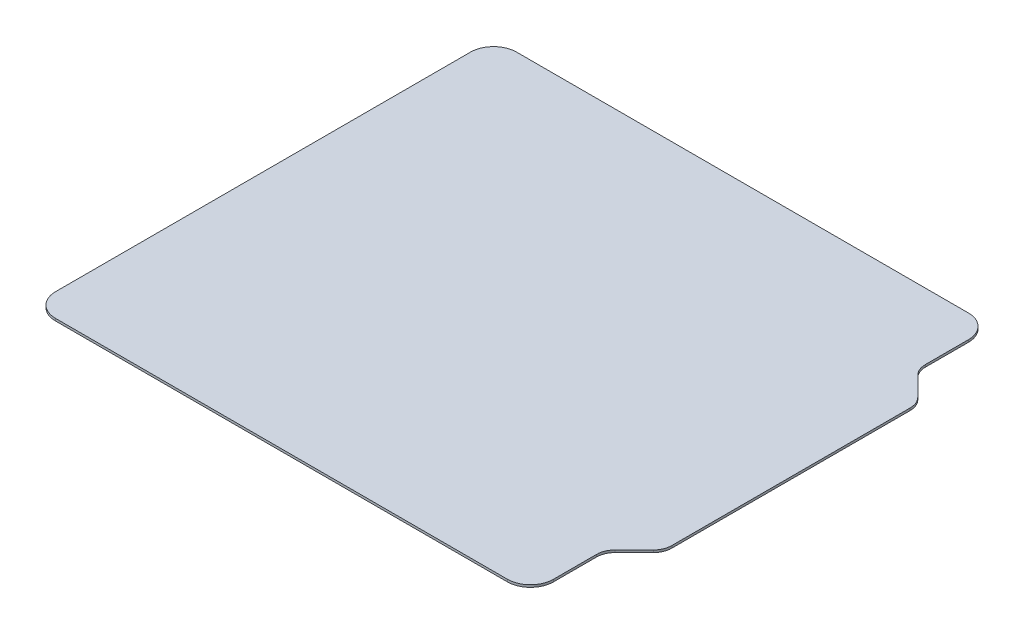
from build123d import *

# Parameters (mm, degrees)
SKETCH1_W           = 229
SKETCH1_H           = 200
BOSS_EXTRUDE1_DEPTH = 1
CUT_EXTRUDE1_DEPTH  = 153.023846814
FILLET1_R           = 8
FILLET2_R           = 10


with BuildPart() as part:
    # Sketch1 → Boss-Extrude1 (new body)
    with BuildSketch(Plane(origin=(0, 0, 0), x_dir=(1, 0, 0), z_dir=(0, 1, 0))):
        Rectangle(SKETCH1_W, SKETCH1_H)
    extrude(amount=BOSS_EXTRUDE1_DEPTH)

    # Sketch2 → Cut-Extrude1 (cut, through all)
    with BuildSketch(Plane(origin=(0, 1, 0), x_dir=(1, 0, 0), z_dir=(0, 1, 0))):
        Polygon((114.5, 55), (101.5, 68), (101.5, 100), (114.5, 100), align=None)
        Polygon((101.5, -100), (114.5, -100), (114.5, -55), (101.5, -68), align=None)
    extrude(amount=-CUT_EXTRUDE1_DEPTH, mode=Mode.SUBTRACT)

    # Fillet1
    fillet1_edges = [part.edges().sort_by_distance(p)[0] for p in [
        (101.5, 0.5, 68),
        (114.5, 0.5, 55),
        (114.5, 0.5, -55),
        (101.5, 0.5, -68),
    ]]
    fillet(fillet1_edges, radius=FILLET1_R)

    # Fillet2
    fillet2_edges = [part.edges().sort_by_distance(p)[0] for p in [
        (-114.5, 0.5, -100),
        (-114.5, 0.5, 100),
        (101.5, 0.5, 100),
        (101.5, 0.5, -100),
    ]]
    fillet(fillet2_edges, radius=FILLET2_R)


solid = part.part
